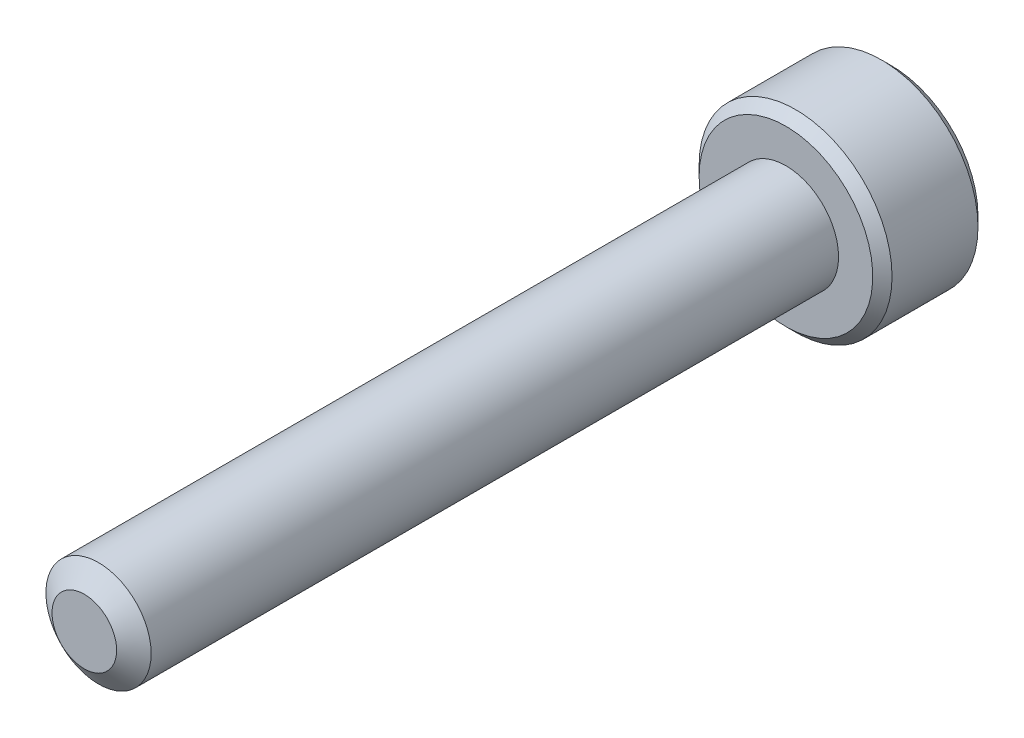
from build123d import *

# Parameters (mm, degrees)
SKETCH1_R          = 1.5
EXTRUDE1_DEPTH     = 20
SKETCH6_R          = 2.75
EXTRUDE2_DEPTH     = 3
CUT_EXTRUDE1_DEPTH = 1.875
CHAMFER1_SIZE      = 0.275


with BuildPart() as part:
    # Sketch1 → Extrude1 (new body)
    with BuildSketch(Plane.XY):
        Circle(SKETCH1_R)
    extrude(amount=-EXTRUDE1_DEPTH)

    # Sketch4 → Cut-Revolve1 (revolve, cut)
    with BuildSketch(Plane(origin=(0, 0, 0), x_dir=(0, 0, -1), z_dir=(1, 0, 0))):
        Polygon((0.405251783, 1.5), (0, 0.921240474), (0, 1.5), align=None)
    revolve(axis=Axis((0, 0, 0), (0, 0, -1)), mode=Mode.SUBTRACT)

    # Sketch6 → Extrude2 (add)
    with BuildSketch(Plane(origin=(0, 0, -20), x_dir=(-1, 0, 0), z_dir=(0, 0, -1))):
        Circle(SKETCH6_R)
    extrude(amount=EXTRUDE2_DEPTH)

    # Sketch7 → Cut-Extrude1 (cut)
    with BuildSketch(Plane(origin=(0, 0, -23), x_dir=(-1, 0, 0), z_dir=(0, 0, -1))):
        Polygon((0, 1.443375673), (-1.25, 0.721687836), (-1.25, -0.721687836), (0, -1.443375673), (1.25, -0.721687836), (1.25, 0.721687836), align=None)
    extrude(amount=-CUT_EXTRUDE1_DEPTH, mode=Mode.SUBTRACT)

    # Cut-Extrude2 cone 1 section (through the dimple's axis) → Cut-Extrude2 (revolve, cut)
    with BuildSketch(Plane(origin=(0, 0, -23), x_dir=(0, 1, 0), z_dir=(1, 0, 0))):
        Polygon((0, 0), (1.443375673, 0), (0, 1.443375673), align=None)
    revolve(axis=Axis((0, 0, -23), (0, 0, 1)), mode=Mode.SUBTRACT)

    # Chamfer1
    chamfer1_edges = [part.edges().sort_by_distance(p)[0] for p in [
        (2.75, 0, -23),
        (2.75, 0, -20),
    ]]
    chamfer(chamfer1_edges, length=CHAMFER1_SIZE)


solid = part.part
